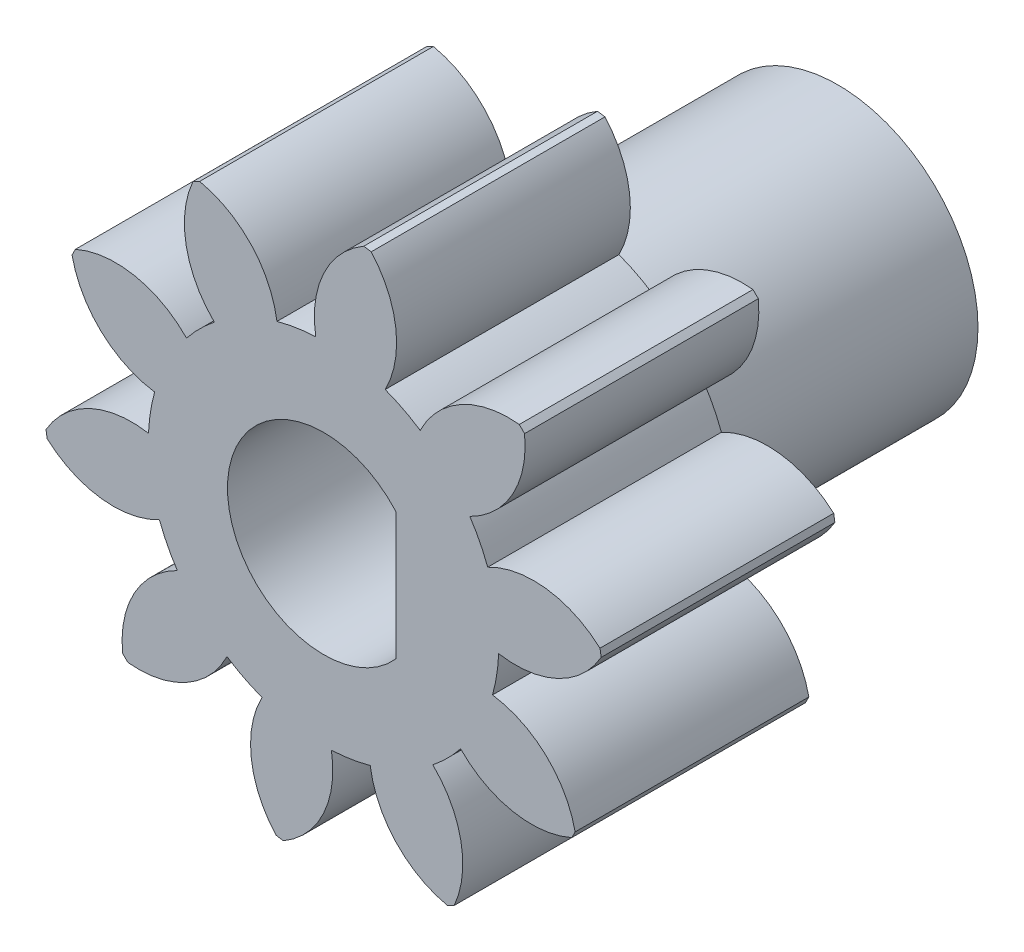
from build123d import *

# Parameters (mm, degrees)
CROQUIS1_R              = 4
SALIENTE_EXTRUIR1_DEPTH = 10
SALIENTE_EXTRUIR2_START = -10
SALIENTE_EXTRUIR2_DEPTH = 10
SALIENTE_EXTRUIR3_START = 12
CROQUIS3_R              = 6
SALIENTE_EXTRUIR3_DEPTH = 12
CAVIDAD2_START          = -12
CAVIDAD2_DEPTH          = 22


# Read off the part's stored shape, not the designer's step: Cavidad2
with BuildPart() as part:
    # Croquis1 → Saliente-Extruir1 (new body)
    with BuildSketch(Plane.XY):
        with BuildLine():
            ThreePointArc((2.63548484, 7.021696352), (3.092608138, 9.517786714), (2.0376941, 11.82572631))
            ThreePointArc((2.0376941, 11.82572631), (1.879375062, 11.85191754), (1.720719944, 11.875989343))
            ThreePointArc((1.720719944, 11.875989343), (0.003562929, 10.007620913), (-0.333938693, 7.492561975))
            ThreePointArc((-0.333938693, 7.492561975), (-1.171907523, 7.4078764), (-1.995097537, 7.2297708))
            ThreePointArc((-1.995097537, 7.2297708), (-3.092442124, 9.517840655), (-5.302458366, 10.764940096))
            ThreePointArc((-5.302458366, 10.764940096), (-5.445935977, 10.693071651), (-5.588439715, 10.61929101))
            ThreePointArc((-5.588439715, 10.61929101), (-5.879449513, 8.098429629), (-4.674179509, 5.86532573))
            ThreePointArc((-4.674179509, 5.86532573), (-5.3023336, 5.304267941), (-5.863620467, 4.676318533))
            ThreePointArc((-5.863620467, 4.676318533), (-8.096284603, 5.882402966), (-10.617251961, 5.592312652))
            ThreePointArc((-10.617251961, 5.592312652), (-10.691084574, 5.449835835), (-10.763005347, 5.306384448))
            ThreePointArc((-10.763005347, 5.306384448), (-9.516712076, 3.095913482), (-7.229042621, 1.997734411))
            ThreePointArc((-7.229042621, 1.997734411), (-7.407448462, 1.174609414), (-7.492439675, 0.336671529))
            ThreePointArc((-7.492439675, 0.336671529), (-10.007621547, 8.7279e-05), (-11.876616173, -1.716388149))
            ThreePointArc((-11.876616173, -1.716388149), (-11.85260224, -1.875052036), (-11.826468757, -2.033380616))
            ThreePointArc((-11.826468757, -2.033380616), (-9.518914087, -3.089136389), (-7.022657159, -2.632923552))
            ThreePointArc((-7.022657159, -2.632923552), (-6.683169782, -3.403709986), (-6.259401586, -4.131572556))
            ThreePointArc((-6.259401586, -4.131572556), (-8.096387206, -5.882261746), (-8.599516679, -8.369487015))
            ThreePointArc((-8.599516679, -8.369487015), (-8.486828706, -8.483733761), (-8.37262307, -8.596463397))
            ThreePointArc((-8.37262307, -8.596463397), (-5.885214453, -8.094241155), (-4.133855353, -6.257894208))
            ThreePointArc((-4.133855353, -6.257894208), (-3.406147397, -6.681927859), (-2.63548484, -7.021696352))
            ThreePointArc((-2.63548484, -7.021696352), (-3.092608138, -9.517786714), (-2.0376941, -11.82572631))
            ThreePointArc((-2.0376941, -11.82572631), (-1.879375062, -11.85191754), (-1.720719944, -11.875989343))
            ThreePointArc((-1.720719944, -11.875989343), (-0.003562929, -10.007620913), (0.333938693, -7.492561975))
            ThreePointArc((0.333938693, -7.492561975), (1.171907523, -7.4078764), (1.995097537, -7.2297708))
            ThreePointArc((1.995097537, -7.2297708), (3.092442124, -9.517840655), (5.302458366, -10.764940096))
            ThreePointArc((5.302458366, -10.764940096), (5.445935977, -10.693071651), (5.588439715, -10.61929101))
            ThreePointArc((5.588439715, -10.61929101), (5.879449513, -8.098429629), (4.674179509, -5.86532573))
            ThreePointArc((4.674179509, -5.86532573), (5.3023336, -5.304267941), (5.863620467, -4.676318533))
            ThreePointArc((5.863620467, -4.676318533), (8.096284603, -5.882402966), (10.617251961, -5.592312652))
            ThreePointArc((10.617251961, -5.592312652), (10.691084574, -5.449835835), (10.763005347, -5.306384448))
            ThreePointArc((10.763005347, -5.306384448), (9.516712076, -3.095913482), (7.229042621, -1.997734411))
            ThreePointArc((7.229042621, -1.997734411), (7.407448462, -1.174609414), (7.492439675, -0.336671529))
            ThreePointArc((7.492439675, -0.336671529), (10.007621547, -8.7279e-05), (11.876616173, 1.716388149))
            ThreePointArc((11.876616173, 1.716388149), (11.85260224, 1.875052036), (11.826468757, 2.033380616))
            ThreePointArc((11.826468757, 2.033380616), (9.518914087, 3.089136389), (7.022657159, 2.632923552))
            ThreePointArc((7.022657159, 2.632923552), (6.683169782, 3.403709986), (6.259401586, 4.131572556))
            ThreePointArc((6.259401586, 4.131572556), (8.096387206, 5.882261746), (8.599516679, 8.369487015))
            ThreePointArc((8.599516679, 8.369487015), (8.486828706, 8.483733761), (8.37262307, 8.596463397))
            ThreePointArc((8.37262307, 8.596463397), (5.885214453, 8.094241155), (4.133855353, 6.257894208))
            ThreePointArc((4.133855353, 6.257894208), (3.406147397, 6.681927859), (2.63548484, 7.021696352))
        make_face()
        Circle(CROQUIS1_R, mode=Mode.SUBTRACT)
    extrude(amount=SALIENTE_EXTRUIR1_DEPTH)

    # Croquis2 → Saliente-Extruir2 (add)
    with BuildSketch(Plane.XY.offset(10).offset(SALIENTE_EXTRUIR2_START)):
        with BuildLine():
            Line((3, 2.645751311), (3, -2.645751311))
            ThreePointArc((3, -2.645751311), (4, 0), (3, 2.645751311))
        make_face()
    extrude(amount=SALIENTE_EXTRUIR2_DEPTH)

    # Croquis3 → Saliente-Extruir3 (add)
    with BuildSketch(Plane(origin=(0, 0, 0), x_dir=(-1, 0, 0), z_dir=(0, 0, -1)).offset(SALIENTE_EXTRUIR3_START)):
        with Locations(Location((0, 0, 0), (0, 0, 180))):
            Circle(CROQUIS3_R)
        with BuildLine():
            Line((-3, -2.645751311), (-3, 2.645751311))
            ThreePointArc((-3, 2.645751311), (4, 0), (-3, -2.645751311))
        make_face(mode=Mode.SUBTRACT)
    extrude(amount=-SALIENTE_EXTRUIR3_DEPTH)

    # Cavidad2 outline → Cavidad2 (cut)
    with BuildSketch(Plane.XY.offset(CAVIDAD2_START)):
        with BuildLine():
            ThreePointArc((3.097941964, 2.72512385), (-4.112058036, 0), (3.097941964, -2.72512385))
            Line((3.097941964, -2.72512385), (3.097941964, 2.72512385))
        make_face()
        with BuildLine():
            Line((3, 2.645751311), (3, -2.645751311))
            ThreePointArc((3, -2.645751311), (-4, 0), (3, 2.645751311))
        make_face(mode=Mode.SUBTRACT)
    extrude(amount=CAVIDAD2_DEPTH, mode=Mode.SUBTRACT)


solid = part.part
